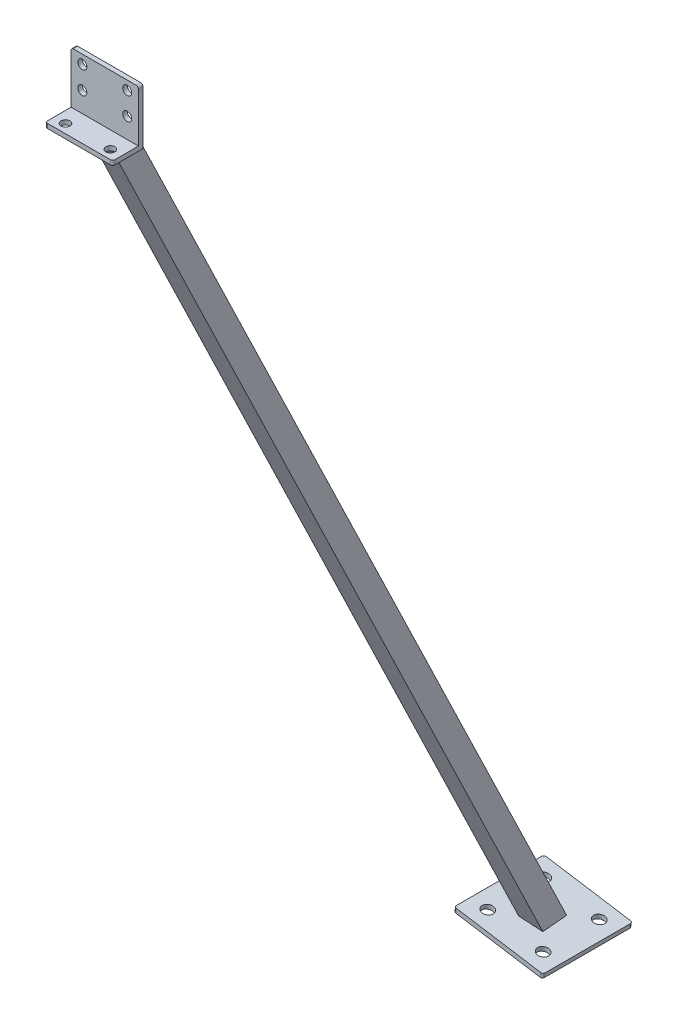
from build123d import *

# Parameters (mm, degrees)
BOSS_EXTRUDE1_DEPTH      = 60
BOSS_EXTRUDE2_DEPTH      = 2000
BOSS_EXTRUDE2_DEPTH_BACK = 20
SKETCH3_W                = 20
SKETCH3_H                = 20
SKETCH3_W_2              = 18
SKETCH3_H_2              = 18
CUT_EXTRUDE1_DEPTH       = 60
SKETCH7_W                = 80
SKETCH7_H                = 80
BOSS_EXTRUDE3_DEPTH      = 4
SKETCH8_W                = 109.20231627
SKETCH8_H                = 482.966945154
CUT_EXTRUDE3_DEPTH       = 1000
CUT_EXTRUDE4_REACH       = 1177.693
SKETCH9_R                = 3.999999996
CUT_EXTRUDE5_REACH       = 1177.693
SKETCH10_R               = 4.000000003
CUT_EXTRUDE6_REACH       = 1218.32
SKETCH11_R               = 5
FILLET1_R                = 2
FILLET2_R                = 2


with BuildPart() as part:
    # Sketch1 → Boss-Extrude1 (new body)
    with BuildSketch(Plane(origin=(0, 0, 0), x_dir=(0, 0, -1), z_dir=(1, 0, 0))):
        Polygon((0, 0), (0, 50), (-4, 50), (-4, 4), (-27, 4), (-27, 0), align=None)
    extrude(amount=BOSS_EXTRUDE1_DEPTH)

    # Sketch3 → Boss-Extrude2 (add, two sides: drawn at the far end of the back side and taken through both)
    with BuildSketch(Plane(origin=(0.734152256, 4.01424851, 2.317627458), x_dir=(0, -0.49999999999998884, 0.866025403784445), z_dir=(-0.1564344650402179, -0.8553631939770945, -0.4938441702975589)).offset(-BOSS_EXTRUDE2_DEPTH_BACK)):
        with Locations((0, -29.630650218)):
            Rectangle(SKETCH3_W, SKETCH3_H)
        with Locations((0, -29.630650218)):
            Rectangle(SKETCH3_W_2, SKETCH3_H_2, mode=Mode.SUBTRACT)
    extrude(amount=BOSS_EXTRUDE2_DEPTH + BOSS_EXTRUDE2_DEPTH_BACK)

    # Sketch5 → Cut-Extrude1 (cut)
    with BuildSketch(Plane.ZY):
        Polygon((4, 4), (4, 36.054903459), (38.781358344, 4), align=None)
    extrude(amount=-CUT_EXTRUDE1_DEPTH, mode=Mode.SUBTRACT)

    # Sketch7 → Boss-Extrude3 (add)
    with BuildSketch(Plane(origin=(-155.547262091, -982.086761679, 2e-09), x_dir=(0.9876883405962854, -0.15643446503298483, 2.850074130140158e-13), z_dir=(0.15643446503298483, 0.9876883405962854, -1.7994659856963007e-12))):
        with Locations((5.477031178, 566.441418592)):
            Rectangle(SKETCH7_W, SKETCH7_H)
    extrude(amount=BOSS_EXTRUDE3_DEPTH)

    # Sketch8 → Cut-Extrude3 (cut)
    with BuildSketch(Plane(origin=(-155.547262091, -982.086761679, 2e-09), x_dir=(0.9876883405962856, -0.15643446503298414, -2.6345368338963644e-10), z_dir=(-0.15643446503298414, -0.9876883405962856, 1.7997198054110175e-12))):
        with Locations((4.33544583, -787.065663544)):
            Rectangle(SKETCH8_W, SKETCH8_H)
    extrude(amount=CUT_EXTRUDE3_DEPTH, mode=Mode.SUBTRACT)

    # Sketch9 → Cut-Extrude4 (cut, up to next)
    with BuildSketch(Plane(origin=(0, 0, 0), x_dir=(-1, 0, 0), z_dir=(0, 0, -1)), mode=Mode.PRIVATE) as cut_extrude4_sk1:
        with Locations((-50, 22)):
            Circle(SKETCH9_R)
    cut_extrude4_tool1 = extrude(cut_extrude4_sk1.sketch, amount=-CUT_EXTRUDE4_REACH, mode=Mode.PRIVATE) & part.part
    # Sketch9 → Cut-Extrude4 (cut, up to next)
    with BuildSketch(Plane(origin=(0, 0, 0), x_dir=(-1, 0, 0), z_dir=(0, 0, -1)), mode=Mode.PRIVATE) as cut_extrude4_sk2:
        with Locations((-10, 22)):
            Circle(SKETCH9_R)
    cut_extrude4_tool2 = extrude(cut_extrude4_sk2.sketch, amount=-CUT_EXTRUDE4_REACH, mode=Mode.PRIVATE) & part.part
    # Sketch9 → Cut-Extrude4 (cut, up to next)
    with BuildSketch(Plane(origin=(0, 0, 0), x_dir=(-1, 0, 0), z_dir=(0, 0, -1)), mode=Mode.PRIVATE) as cut_extrude4_sk3:
        with Locations((-10, 42)):
            Circle(SKETCH9_R)
    cut_extrude4_tool3 = extrude(cut_extrude4_sk3.sketch, amount=-CUT_EXTRUDE4_REACH, mode=Mode.PRIVATE) & part.part
    # Sketch9 → Cut-Extrude4 (cut, up to next)
    with BuildSketch(Plane(origin=(0, 0, 0), x_dir=(-1, 0, 0), z_dir=(0, 0, -1)), mode=Mode.PRIVATE) as cut_extrude4_sk4:
        with Locations((-50, 42)):
            Circle(SKETCH9_R)
    cut_extrude4_tool4 = extrude(cut_extrude4_sk4.sketch, amount=-CUT_EXTRUDE4_REACH, mode=Mode.PRIVATE) & part.part
    add(cut_extrude4_tool1.solids().sort_by_distance((50, 22, 0))[0], mode=Mode.SUBTRACT)
    add(cut_extrude4_tool2.solids().sort_by_distance((10, 22, 0))[0], mode=Mode.SUBTRACT)
    add(cut_extrude4_tool3.solids().sort_by_distance((10, 42, 0))[0], mode=Mode.SUBTRACT)
    add(cut_extrude4_tool4.solids().sort_by_distance((50, 42, 0))[0], mode=Mode.SUBTRACT)

    # Sketch10 → Cut-Extrude5 (cut, up to next)
    with BuildSketch(Plane.XZ, mode=Mode.PRIVATE) as cut_extrude5_sk1:
        with Locations((50, 19)):
            Circle(SKETCH10_R)
    cut_extrude5_tool1 = extrude(cut_extrude5_sk1.sketch, amount=-CUT_EXTRUDE5_REACH, mode=Mode.PRIVATE) & part.part
    # Sketch10 → Cut-Extrude5 (cut, up to next)
    with BuildSketch(Plane.XZ, mode=Mode.PRIVATE) as cut_extrude5_sk2:
        with Locations((10, 19)):
            Circle(SKETCH10_R)
    cut_extrude5_tool2 = extrude(cut_extrude5_sk2.sketch, amount=-CUT_EXTRUDE5_REACH, mode=Mode.PRIVATE) & part.part
    add(cut_extrude5_tool1.solids().sort_by_distance((50, 0, 19))[0], mode=Mode.SUBTRACT)
    add(cut_extrude5_tool2.solids().sort_by_distance((10, 0, 19))[0], mode=Mode.SUBTRACT)

    # Sketch11 → Cut-Extrude6 (cut, up to next)
    with BuildSketch(Plane(origin=(-155.547262091, -982.086761679, 2e-09), x_dir=(0.9876883405962856, -0.15643446503298414, -2.6345368338963665e-10), z_dir=(-0.15643446503298414, -0.9876883405962856, 1.7997198054110563e-12)), mode=Mode.PRIVATE) as cut_extrude6_sk1:
        with Locations((-19.522968662, -541.441418601)):
            Circle(SKETCH11_R)
    cut_extrude6_tool1 = extrude(cut_extrude6_sk1.sketch, amount=-CUT_EXTRUDE6_REACH, mode=Mode.PRIVATE) & part.part
    # Sketch11 → Cut-Extrude6 (cut, up to next)
    with BuildSketch(Plane(origin=(-155.547262091, -982.086761679, 2e-09), x_dir=(0.9876883405962856, -0.15643446503298414, -2.6345368338963665e-10), z_dir=(-0.15643446503298414, -0.9876883405962856, 1.7997198054110563e-12)), mode=Mode.PRIVATE) as cut_extrude6_sk2:
        with Locations((30.477031338, -541.441418601)):
            Circle(SKETCH11_R)
    cut_extrude6_tool2 = extrude(cut_extrude6_sk2.sketch, amount=-CUT_EXTRUDE6_REACH, mode=Mode.PRIVATE) & part.part
    # Sketch11 → Cut-Extrude6 (cut, up to next)
    with BuildSketch(Plane(origin=(-155.547262091, -982.086761679, 2e-09), x_dir=(0.9876883405962856, -0.15643446503298414, -2.6345368338963665e-10), z_dir=(-0.15643446503298414, -0.9876883405962856, 1.7997198054110563e-12)), mode=Mode.PRIVATE) as cut_extrude6_sk3:
        with Locations((30.477031338, -591.441418601)):
            Circle(SKETCH11_R)
    cut_extrude6_tool3 = extrude(cut_extrude6_sk3.sketch, amount=-CUT_EXTRUDE6_REACH, mode=Mode.PRIVATE) & part.part
    # Sketch11 → Cut-Extrude6 (cut, up to next)
    with BuildSketch(Plane(origin=(-155.547262091, -982.086761679, 2e-09), x_dir=(0.9876883405962856, -0.15643446503298414, -2.6345368338963665e-10), z_dir=(-0.15643446503298414, -0.9876883405962856, 1.7997198054110563e-12)), mode=Mode.PRIVATE) as cut_extrude6_sk4:
        with Locations((-19.522968662, -591.441418601)):
            Circle(SKETCH11_R)
    cut_extrude6_tool4 = extrude(cut_extrude6_sk4.sketch, amount=-CUT_EXTRUDE6_REACH, mode=Mode.PRIVATE) & part.part
    add(cut_extrude6_tool1.solids().sort_by_distance((-174.829871, -979.032696, -541.441419))[0], mode=Mode.SUBTRACT)
    add(cut_extrude6_tool2.solids().sort_by_distance((-125.445454, -986.85442, -541.441419))[0], mode=Mode.SUBTRACT)
    add(cut_extrude6_tool3.solids().sort_by_distance((-125.445454, -986.85442, -591.441419))[0], mode=Mode.SUBTRACT)
    add(cut_extrude6_tool4.solids().sort_by_distance((-174.829871, -979.032696, -591.441419))[0], mode=Mode.SUBTRACT)

    # Fillet1
    fillet1_edges = [part.edges().sort_by_distance(p)[0] for p in [
        (60, 2, 27),
        (0, 2, 27),
        (0, 50, 2),
        (60, 50, 2),
    ]]
    fillet(fillet1_edges, radius=FILLET1_R)

    # Fillet2
    fillet2_edges = [part.edges().sort_by_distance(p)[0] for p in [
        (-110.317259702, -987.225560043, -606.44141859),
        (-189.332326949, -974.71080284, -606.44141859),
        (-110.317259702, -987.225560043, -526.44141859),
        (-189.332326949, -974.71080284, -526.44141859),
    ]]
    fillet(fillet2_edges, radius=FILLET2_R)


solid = part.part
